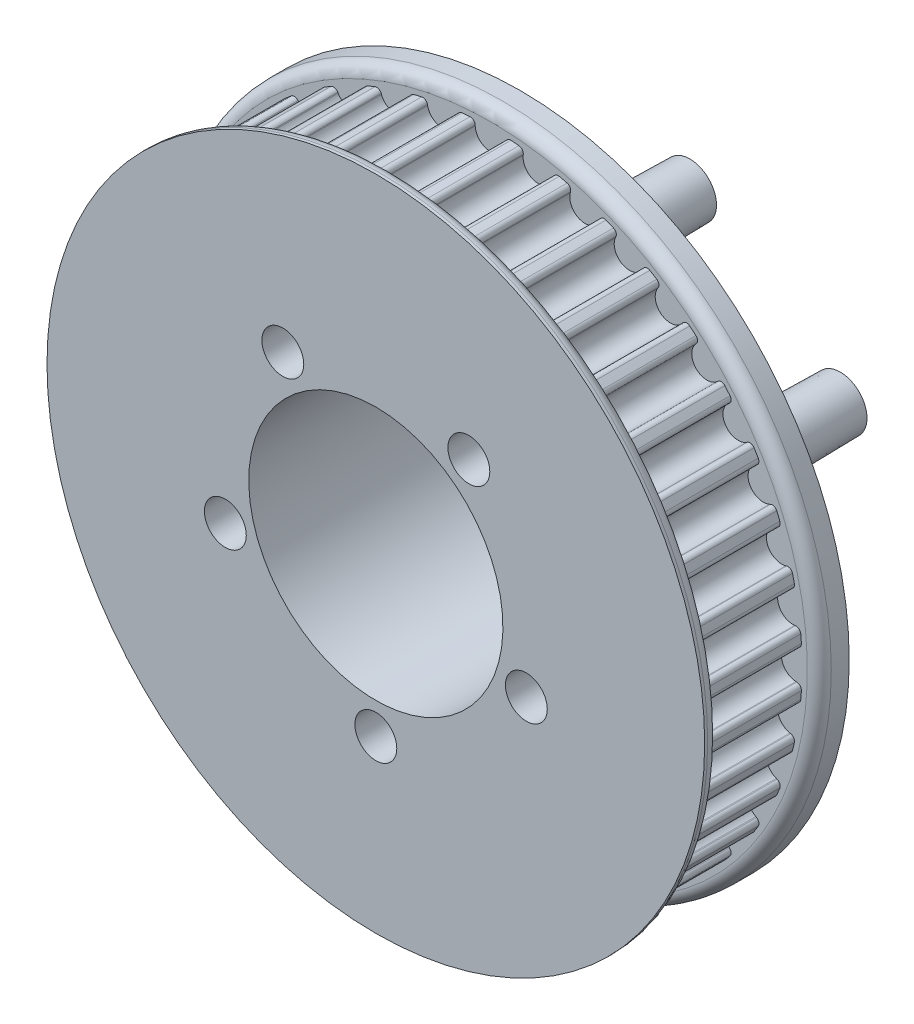
from build123d import *

# Parameters (mm, degrees)
SKETCH_3_R                       = 31.259488618379066
EXTRUDE_2_DEPTH                  = 10
CUT_EXTRUDE_2_DEPTH              = 46.324510558473115
FILLET_1_R                       = 0.48
PATTERN_CIRCULAR_1_COUNT         = 40
FILLET_1_OF_PATTERN_CIRCULAR_1_R = 0.48
SKETCH_8_R                       = 32.98948861837907
EXTRUDE_3_DEPTH                  = 1.5
EXTRUDE_START                    = 3
SKETCH_9_R                       = 32.98948861837907
EXTRUDE_4_DEPTH                  = 3
SKETCH_10_R                      = 2.675
SKETCH_10_R_2                    = 2.674999999999999
SKETCH_10_R_3                    = 2.6750000000000007
EXTRUDE_5_DEPTH                  = 20
M5X0_8_2_D                       = 4.2
DRAFT_1_ANGLE                    = 1.0000000000000022
SKETCH_4_R                       = 12.75
CUT_EXTRUDE_3_DEPTH              = 54.734203967213055
FILLET_2_R                       = 1.2


with BuildPart() as part:
    # 스케치3 → 보스-돌출2 (new body)
    with BuildSketch(Plane.XY):
        Circle(SKETCH_3_R)
    extrude(amount=EXTRUDE_2_DEPTH)

    # 스케치3<3> → 컷-돌출2 (cut, symmetric)
    with BuildSketch(Plane.XY):
        with BuildLine():
            Line((-1.5617286792044034, 31.220452146231334), (-1.5330831105243496, 30.647799791129046))
            ThreePointArc((-1.5330831105243503, 30.647799791129046), (-2.8e-16, 29.189488618379063), (1.53308311052435, 30.647799791129046))
            Line((1.5330831105243496, 30.647799791129046), (1.5617286792044034, 31.220452146231334))
            ThreePointArc((1.5617286792044034, 31.220452146231334), (-2.2e-16, 31.259488618379066), (-1.5617286792044032, 31.220452146231338))
        make_face()
    cut_extrude_2 = extrude(amount=CUT_EXTRUDE_2_DEPTH, both=True, mode=Mode.SUBTRACT)

    # 필렛1
    fillet_1_edges = [part.edges().sort_by_distance(p)[0] for p in [
        (1.5617286792044034, 31.220452146231338, 5),
        (-1.5617286792044036, 31.220452146231338, 5),
    ]]
    fillet(fillet_1_edges, radius=FILLET_1_R)

    # 원형 패턴1: 컷-돌출2 ×40 about axis
    pattern_circular_1_axis = Axis((0, 0, 10), (0, 0, -1))
    for i in range(1, PATTERN_CIRCULAR_1_COUNT):
        add(cut_extrude_2.rotate(pattern_circular_1_axis, i * 360 / PATTERN_CIRCULAR_1_COUNT), mode=Mode.SUBTRACT)

    # 필렛1 of 원형 패턴1
    fillet_1_of_pattern_circular_1_edges = [part.edges().sort_by_distance(p)[0] for p in [
        (6.42645593743306, 30.591768382471813, 5),
        (3.341453522186593, 31.080384763410464, 5),
        (11.132942522297654, 29.209813752877423, 5),
        (8.162358048212912, 30.175015157831226, 5),
        (15.565299114145375, 27.108616566873266, 5),
        (12.782278229778964, 28.526636533932447, 5),
        (19.614386383536775, 24.3399152726524, 5),
        (17.087456299378566, 26.175837444089506, 5),
        (23.180502363749223, 20.97188448487134, 5),
        (20.971884484871335, 23.180502363749227, 5),
        (26.175837444089506, 17.087456299378566, 5),
        (24.3399152726524, 19.614386383536775, 5),
        (28.526636533932443, 12.782278229778965, 5),
        (27.108616566873263, 15.565299114145377, 5),
        (30.175015157831226, 8.162358048212914, 5),
        (29.209813752877423, 11.132942522297656, 5),
        (31.080384763410464, 3.3414535221865953, 5),
        (30.591768382471813, 6.4264559374330625, 5),
        (31.220452146231338, -1.5617286792044014, 5),
        (31.220452146231338, 1.5617286792044056, 5),
        (30.591768382471813, -6.426455937433058, 5.000000000000001),
        (31.080384763410464, -3.3414535221865913, 5.000000000000001),
        (29.209813752877427, -11.132942522297652, 5),
        (30.17501515783123, -8.16235804821291, 5),
        (27.108616566873266, -15.565299114145374, 5),
        (28.526636533932447, -12.782278229778962, 5),
        (24.3399152726524, -19.614386383536768, 5.000000000000001),
        (26.175837444089506, -17.087456299378562, 5.000000000000001),
        (20.97188448487134, -23.180502363749223, 5),
        (23.180502363749227, -20.971884484871335, 5),
        (17.087456299378573, -26.175837444089503, 5),
        (19.614386383536775, -24.339915272652398, 5),
        (12.782278229778967, -28.526636533932443, 5),
        (15.565299114145379, -27.108616566873263, 5),
        (8.162358048212916, -30.175015157831226, 5),
        (11.132942522297657, -29.209813752877423, 5),
        (3.3414535221865975, -31.08038476341046, 5),
        (6.426455937433063, -30.59176838247181, 5),
        (-1.5617286792043996, -31.220452146231338, 5),
        (1.5617286792044074, -31.220452146231338, 5),
        (-6.426455937433056, -30.591768382471813, 5),
        (-3.3414535221865886, -31.080384763410464, 5),
        (-11.13294252229765, -29.209813752877427, 5),
        (-8.162358048212909, -30.17501515783123, 5),
        (-15.565299114145374, -27.108616566873266, 5.000000000000001),
        (-12.782278229778962, -28.526636533932447, 5.000000000000001),
        (-19.61438638353677, -24.339915272652405, 5.000000000000001),
        (-17.087456299378562, -26.17583744408951, 5.000000000000001),
        (-23.180502363749223, -20.971884484871342, 5),
        (-20.971884484871335, -23.18050236374923, 5),
        (-26.175837444089503, -17.087456299378573, 5),
        (-24.339915272652398, -19.614386383536775, 5),
        (-28.526636533932443, -12.782278229778969, 5),
        (-27.108616566873263, -15.56529911414538, 5),
        (-30.175015157831226, -8.162358048212917, 5.000000000000001),
        (-29.209813752877423, -11.13294252229766, 5.000000000000001),
        (-31.08038476341046, -3.3414535221865993, 5.000000000000001),
        (-30.59176838247181, -6.426455937433065, 5.000000000000001),
        (-31.220452146231338, 1.5617286792043976, 5),
        (-31.220452146231338, -1.5617286792044094, 5),
        (-30.591768382471813, 6.4264559374330545, 5),
        (-31.080384763410464, 3.341453522186587, 5),
        (-29.209813752877427, 11.132942522297649, 5),
        (-30.17501515783123, 8.162358048212907, 5),
        (-27.10861656687327, 15.565299114145372, 5),
        (-28.52663653393245, 12.78227822977896, 5),
        (-24.339915272652405, 19.614386383536768, 5),
        (-26.17583744408951, 17.08745629937856, 5),
        (-20.971884484871342, 23.18050236374922, 5),
        (-23.18050236374923, 20.97188448487133, 5),
        (-17.087456299378577, 26.175837444089503, 5),
        (-19.614386383536782, 24.339915272652398, 5),
        (-12.78227822977897, 28.526636533932443, 5),
        (-15.565299114145382, 27.108616566873263, 5),
        (-8.16235804821292, 30.175015157831226, 5),
        (-11.132942522297661, 29.209813752877423, 5),
        (-3.341453522186602, 31.08038476341046, 5),
        (-6.426455937433069, 30.59176838247181, 5),
    ]]
    fillet(fillet_1_of_pattern_circular_1_edges, radius=FILLET_1_OF_PATTERN_CIRCULAR_1_R)

    # 스케치8 → 보스-돌출3 (add)
    with BuildSketch(Plane.XY.offset(10)):
        Circle(SKETCH_8_R)
    extrude(amount=EXTRUDE_3_DEPTH)

    # 스케치9 → 보스-돌출4 (add)
    with BuildSketch(Plane(origin=(0, 0, 0), x_dir=(-1, 0, 0), z_dir=(0, 0, -1)).offset(EXTRUDE_START)):
        Circle(SKETCH_9_R)
    extrude(amount=-EXTRUDE_4_DEPTH)

    # 스케치7 → 회전2 (revolve)
    with BuildSketch(Plane.ZY):
        with BuildLine():
            Line((-15.159931583815897, 11), (-15.159931583815897, 0))
            Line((-15.159931583815897, 0), (-1.5048084985283232, 0))
            Line((-1.5048084985283234, 0), (-1.5048084985283237, 27.097837622782833))
            Line((-1.5048084985283228, 27.097837622782833), (-5.4, 29.346727484702612))
            ThreePointArc((-5.399999999999999, 29.346727484702612), (-6.909263836715436, 25.810608836735433), (-7.75480849852833, 22.06))
            ThreePointArc((-7.754808498528325, 22.06), (-13.137719623884404, 17.655062883028585), (-15.159931583815897, 11))
        make_face()
    revolve(axis=Axis((0, 0, -15.159931583815897), (0, 0, 1)))

    # 스케치10 → 보스-돌출5 (add)
    with BuildSketch(Plane.XY):
        with Locations((0, 15.875)):
            Circle(SKETCH_10_R)
        with Locations((15.098022196185564, 4.905644785702292)):
            Circle(SKETCH_10_R_2)
        with Locations((9.331090880143012, -12.84314478570229)):
            Circle(SKETCH_10_R_3)
        with Locations((-9.33109088014301, -12.843144785702291)):
            Circle(SKETCH_10_R_3)
        with Locations((-15.098022196185564, 4.905644785702288)):
            Circle(SKETCH_10_R_3)
    extrude(amount=-EXTRUDE_5_DEPTH)

    # M5x0.8 탭을 위한 탭 드릴2 (through all)
    with Locations(Plane(origin=(0, 0, 11.5), x_dir=(-1, 0, 0), z_dir=(0, 0, 1))):
        with Locations((-15.098022196, 4.905644786), (0, 15.875), (15.098022196, 4.905644786), (9.33109088, -12.843144786), (-9.33109088, -12.843144786)):
            Hole(M5X0_8_2_D / 2)

    # 구배1
    draft_1_faces = [part.faces().sort_by_distance(p)[0] for p in [
        (12.423022196185565, 4.905644785702292, -16.23796648844078),
        (6.656090880143012, -12.843144785702288, -16.237885558702423),
        (-12.006090880143011, -12.843144785702291, -16.23800500386938),
        (-17.773022196185565, 4.905644785702288, -16.23793825170739),
        (-2.675, 15.875, -16.23811130127922),
    ]]
    draft(draft_1_faces, Plane(origin=(0, 15.875, -20), x_dir=(-1, 0, 0), z_dir=(0, 0, -1)), DRAFT_1_ANGLE)

    # 스케치4 → 컷-돌출3 (cut, through all)
    with BuildSketch(Plane(origin=(0, 0, -15.159931583815897), x_dir=(-1, 0, 0), z_dir=(0, 0, -1))):
        Circle(SKETCH_4_R)
    extrude(amount=-CUT_EXTRUDE_3_DEPTH, mode=Mode.SUBTRACT)

    # 필렛2
    fillet_2_edges = [part.edges().sort_by_distance(p)[0] for p in [
        (-32.98948861837907, 4.04e-15, 10),
        (32.98948861837907, 4.04e-15, 0),
    ]]
    fillet(fillet_2_edges, radius=FILLET_2_R)


solid = part.part
